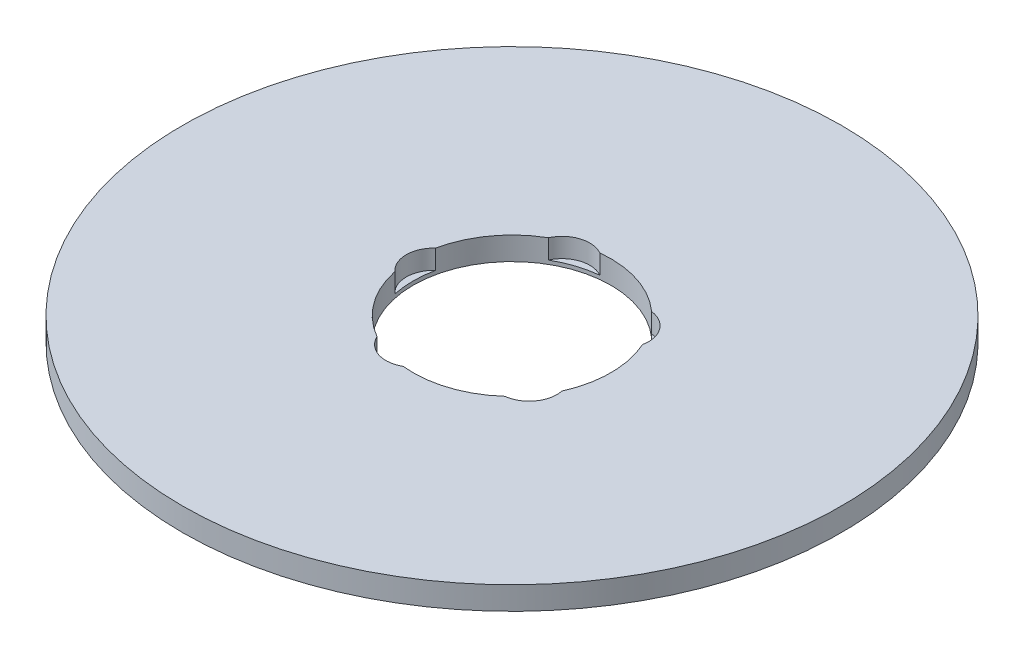
from build123d import *

# Parameters (mm, degrees)
SKETCH1_R           = 100
BOSS_EXTRUDE1_DEPTH = 7
SKETCH2_R           = 30
CUT_EXTRUDE1_DEPTH  = 142.594491418
SKETCH3_R           = 8.416065229
CUT_EXTRUDE2_DEPTH  = 5.863859483
CIRPATTERN1_COUNT   = 5


with BuildPart() as part:
    # Sketch1 → Boss-Extrude1 (new body)
    with BuildSketch(Plane(origin=(0, 0, 0), x_dir=(1, 0, 0), z_dir=(0, 1, 0))):
        Circle(SKETCH1_R)
    extrude(amount=BOSS_EXTRUDE1_DEPTH)

    # Sketch2 → Cut-Extrude1 (cut, through all)
    with BuildSketch(Plane(origin=(0, 0, 0), x_dir=(1, 0, 0), z_dir=(0, 1, 0))):
        Circle(SKETCH2_R)
    extrude(amount=CUT_EXTRUDE1_DEPTH, mode=Mode.SUBTRACT)

    # Sketch3 → Cut-Extrude2 (cut)
    with BuildSketch(Plane(origin=(0, 7, 0), x_dir=(1, 0, 0), z_dir=(0, 1, 0))):
        with Locations((-23.656964021, 0)):
            Circle(SKETCH3_R)
    cut_extrude2 = extrude(amount=-CUT_EXTRUDE2_DEPTH, mode=Mode.SUBTRACT)

    # CirPattern1: Cut-Extrude2 ×5 about axis
    cirpattern1_axis = Axis((0, 0, 0), (0, 1, 0))
    for i in range(1, CIRPATTERN1_COUNT):
        add(cut_extrude2.rotate(cirpattern1_axis, i * 360 / CIRPATTERN1_COUNT), mode=Mode.SUBTRACT)


solid = part.part
